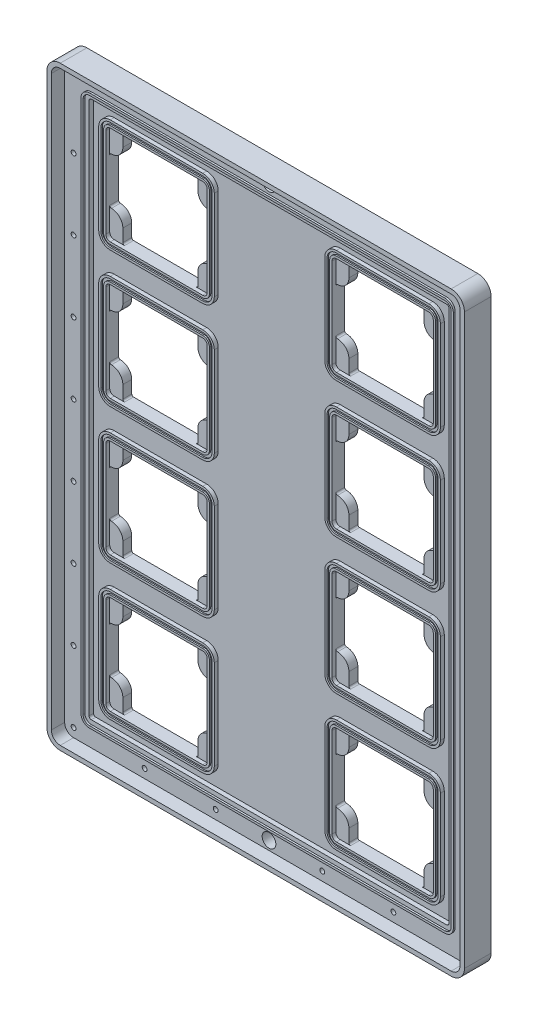
from build123d import *

# Parameters (mm, degrees)
SKETCH1_W            = 292.1
SKETCH1_H            = 419.1
BOSS_EXTRUDE1_DEPTH  = 9.525
SKETCH4_R            = 1.7272
CUT_EXTRUDE1_DEPTH   = 6.985
LPATTERN2_COUNT      = 8
LPATTERN2_PITCH      = 50.8
CUT_EXTRUDE3_DEPTH   = 3.175
BOSS_EXTRUDE2_DEPTH  = 1.3335
FILLET1_R            = 6.35
CUT_EXTRUDE5_DEPTH   = 3.175
CUT_EXTRUDE6_DEPTH   = 511.964898033
SKETCH11_R           = 1.1303
CUT_EXTRUDE7_DEPTH   = 3.96875
BOSS_EXTRUDE3_DEPTH  = 2.794
BOSS_EXTRUDE4_DEPTH  = 1.778
LPATTERN1_COUNT      = 2
LPATTERN1_PITCH      = 161.5948
LPATTERN1_COUNT_DIR2 = 4
LPATTERN1_PITCH_DIR2 = 96.8756
BOSS_EXTRUDE5_START  = -19.05
BOSS_EXTRUDE5_DEPTH  = 19.05
SKETCH14_R           = 1.7272
CUT_EXTRUDE8_DEPTH   = 6.985
SKETCH15_R           = 4.9022
CUT_EXTRUDE9_DEPTH   = 516.358348021
LPATTERN3_COUNT      = 2
LPATTERN3_PITCH      = 406.4


with BuildPart() as part:
    # Sketch1 → Boss-Extrude1 (new body)
    with BuildSketch(Plane.XY):
        with Locations((146.05, 209.55)):
            Rectangle(SKETCH1_W, SKETCH1_H)
    extrude(amount=BOSS_EXTRUDE1_DEPTH)

    # Sketch4 → Cut-Extrude1 (cut)
    with BuildSketch(Plane.XY.offset(9.525)):
        with Locations((6.35, 6.35)):
            Circle(SKETCH4_R)
        with Locations((6.35, 412.75)):
            Circle(SKETCH4_R)
        with Locations((285.75, 412.75)):
            Circle(SKETCH4_R)
        with Locations((285.75, 6.35)):
            Circle(SKETCH4_R)
    cut_extrude1 = extrude(amount=-CUT_EXTRUDE1_DEPTH, mode=Mode.SUBTRACT)

    # LPattern2: Cut-Extrude1 ×8
    with Locations(*[(0, -i * LPATTERN2_PITCH, 0) for i in range(1, LPATTERN2_COUNT)]):
        add(cut_extrude1, mode=Mode.SUBTRACT)

    # Sketch6 → Cut-Extrude3 (cut)
    with BuildSketch(Plane.XY.offset(9.525)):
        with BuildLine():
            Line((273.05, 401.6375), (19.05, 401.6375))
            ThreePointArc((19.05, 401.6375), (17.927467985, 401.172532015), (17.4625, 400.05))
            Line((17.4625, 400.05), (17.4625, 19.05))
            ThreePointArc((17.4625, 19.05), (17.927467985, 17.927467985), (19.05, 17.4625))
            Line((19.05, 17.4625), (273.05, 17.4625))
            ThreePointArc((273.05, 17.4625), (274.172532015, 17.927467985), (274.6375, 19.05))
            Line((274.6375, 19.05), (274.6375, 400.05))
            ThreePointArc((274.6375, 400.05), (274.172532015, 401.172532015), (273.05, 401.6375))
        make_face()
    extrude(amount=-CUT_EXTRUDE3_DEPTH, mode=Mode.SUBTRACT)

    # Sketch5 → Boss-Extrude2 (add)
    with BuildSketch(Plane.XY.offset(9.525)):
        with BuildLine():
            ThreePointArc((19.05, 406.146), (14.739477062, 404.360522938), (12.954, 400.05))
            Line((12.954, 400.05), (12.954, 19.05))
            ThreePointArc((12.954, 19.05), (14.739477062, 14.739477062), (19.05, 12.954))
            Line((19.05, 12.954), (273.05, 12.954))
            ThreePointArc((273.05, 12.954), (277.360522938, 14.739477062), (279.146, 19.05))
            Line((279.146, 19.05), (279.146, 400.05))
            ThreePointArc((279.146, 400.05), (277.360522938, 404.360522938), (273.05, 406.146))
            Line((273.05, 406.146), (19.05, 406.146))
        make_face()
        with BuildLine():
            ThreePointArc((273.05, 404.622), (276.282892204, 403.282892204), (277.622, 400.05))
            Line((277.622, 400.05), (277.622, 19.05))
            ThreePointArc((277.622, 19.05), (276.282892204, 15.817107796), (273.05, 14.478))
            Line((273.05, 14.478), (19.05, 14.478))
            ThreePointArc((19.05, 14.478), (15.817107796, 15.817107796), (14.478, 19.05))
            Line((14.478, 19.05), (14.478, 400.05))
            ThreePointArc((14.478, 400.05), (15.817107796, 403.282892204), (19.05, 404.622))
            Line((19.05, 404.622), (273.05, 404.622))
        make_face(mode=Mode.SUBTRACT)
    extrude(amount=BOSS_EXTRUDE2_DEPTH)

    # Fillet1
    fillet1_edges = [part.edges().sort_by_distance(p)[0] for p in [
        (0, 419.1, 4.7625),
        (292.1, 419.1, 4.7625),
        (0, 0, 4.7625),
        (292.1, 0, 4.7625),
    ]]
    fillet(fillet1_edges, radius=FILLET1_R)

    # Sketch8 → Cut-Extrude5 (cut)
    with BuildSketch(Plane(origin=(0, 0, 0), x_dir=(-1, 0, 0), z_dir=(0, 0, -1))):
        with BuildLine():
            Line((-201.2442, 393.7), (-252.4506, 393.7))
            ThreePointArc((-252.4506, 393.7), (-255.881057838, 392.279057838), (-257.302, 388.8486))
            Line((-257.302, 388.8486), (-257.302, 379.857))
            ThreePointArc((-257.302, 379.857), (-258.633668309, 376.642068309), (-261.8486, 375.3104))
            ThreePointArc((-261.8486, 375.3104), (-265.279057838, 373.889457838), (-266.7, 370.459))
            Line((-266.7, 370.459), (-266.7, 339.2678))
            ThreePointArc((-266.7, 339.2678), (-265.279057838, 335.837342162), (-261.8486, 334.4164))
            ThreePointArc((-261.8486, 334.4164), (-258.633668309, 333.084731691), (-257.302, 329.8698))
            Line((-257.302, 329.8698), (-257.302, 320.8782))
            ThreePointArc((-257.302, 320.8782), (-255.881057838, 317.447742162), (-252.4506, 316.0268))
            Line((-252.4506, 316.0268), (-201.2442, 316.0268))
            ThreePointArc((-201.2442, 316.0268), (-197.813742162, 317.447742162), (-196.3928, 320.8782))
            Line((-196.3928, 320.8782), (-196.3928, 329.8698))
            ThreePointArc((-196.3928, 329.8698), (-195.061131691, 333.084731691), (-191.8462, 334.4164))
            ThreePointArc((-191.8462, 334.4164), (-188.415742162, 335.837342162), (-186.9948, 339.2678))
            Line((-186.9948, 339.2678), (-186.9948, 370.459))
            ThreePointArc((-186.9948, 370.459), (-188.415742162, 373.889457838), (-191.8462, 375.3104))
            ThreePointArc((-191.8462, 375.3104), (-195.061131691, 376.642068309), (-196.3928, 379.857))
            Line((-196.3928, 379.857), (-196.3928, 388.8486))
            ThreePointArc((-196.3928, 388.8486), (-197.813742162, 392.279057838), (-201.2442, 393.7))
        make_face()
        with BuildLine():
            Line((-264.668, 370.459), (-264.668, 339.2678))
            ThreePointArc((-264.668, 339.2678), (-263.842216859, 337.274183141), (-261.8486, 336.4484))
            ThreePointArc((-261.8486, 336.4484), (-257.196827329, 334.521572671), (-255.27, 329.8698))
            Line((-255.27, 329.8698), (-255.27, 320.8782))
            ThreePointArc((-255.27, 320.8782), (-254.444216859, 318.884583141), (-252.4506, 318.0588))
            Line((-252.4506, 318.0588), (-201.2442, 318.0588))
            ThreePointArc((-201.2442, 318.0588), (-199.250583141, 318.884583141), (-198.4248, 320.8782))
            Line((-198.4248, 320.8782), (-198.4248, 329.8698))
            ThreePointArc((-198.4248, 329.8698), (-196.497972671, 334.521572671), (-191.8462, 336.4484))
            ThreePointArc((-191.8462, 336.4484), (-189.852583141, 337.274183141), (-189.0268, 339.2678))
            Line((-189.0268, 339.2678), (-189.0268, 370.459))
            ThreePointArc((-189.0268, 370.459), (-189.852583141, 372.452616859), (-191.8462, 373.2784))
            ThreePointArc((-191.8462, 373.2784), (-196.497972671, 375.205227329), (-198.4248, 379.857))
            Line((-198.4248, 379.857), (-198.4248, 388.8486))
            ThreePointArc((-198.4248, 388.8486), (-199.250583141, 390.842216859), (-201.2442, 391.668))
            Line((-201.2442, 391.668), (-252.4506, 391.668))
            ThreePointArc((-252.4506, 391.668), (-254.444216859, 390.842216859), (-255.27, 388.8486))
            Line((-255.27, 388.8486), (-255.27, 379.857))
            ThreePointArc((-255.27, 379.857), (-257.196827329, 375.205227329), (-261.8486, 373.2784))
            ThreePointArc((-261.8486, 373.2784), (-263.842216859, 372.452616859), (-264.668, 370.459))
        make_face(mode=Mode.SUBTRACT)
    cut_extrude5 = extrude(amount=-CUT_EXTRUDE5_DEPTH, mode=Mode.SUBTRACT)

    # Sketch10 → Cut-Extrude6 (cut, through all)
    with BuildSketch(Plane(origin=(0, 0, 0), x_dir=(-1, 0, 0), z_dir=(0, 0, -1))):
        with BuildLine():
            Line((-263.0805, 370.459), (-263.0805, 339.2678))
            ThreePointArc((-263.0805, 339.2678), (-262.719684844, 338.396715156), (-261.8486, 338.0359))
            ThreePointArc((-261.8486, 338.0359), (-256.074295314, 335.644104686), (-253.6825, 329.8698))
            Line((-253.6825, 329.8698), (-253.6825, 320.8782))
            ThreePointArc((-253.6825, 320.8782), (-253.321684844, 320.007115156), (-252.4506, 319.6463))
            Line((-252.4506, 319.6463), (-201.2442, 319.6463))
            ThreePointArc((-201.2442, 319.6463), (-200.373115156, 320.007115156), (-200.0123, 320.8782))
            Line((-200.0123, 320.8782), (-200.0123, 329.8698))
            ThreePointArc((-200.0123, 329.8698), (-197.620504686, 335.644104686), (-191.8462, 338.0359))
            ThreePointArc((-191.8462, 338.0359), (-190.975115156, 338.396715156), (-190.6143, 339.2678))
            Line((-190.6143, 339.2678), (-190.6143, 370.459))
            ThreePointArc((-190.6143, 370.459), (-190.975115156, 371.330084844), (-191.8462, 371.6909))
            ThreePointArc((-191.8462, 371.6909), (-197.620504686, 374.082695314), (-200.0123, 379.857))
            Line((-200.0123, 379.857), (-200.0123, 388.8486))
            ThreePointArc((-200.0123, 388.8486), (-200.373115156, 389.719684844), (-201.2442, 390.0805))
            Line((-201.2442, 390.0805), (-252.4506, 390.0805))
            ThreePointArc((-252.4506, 390.0805), (-253.321684844, 389.719684844), (-253.6825, 388.8486))
            Line((-253.6825, 388.8486), (-253.6825, 379.857))
            ThreePointArc((-253.6825, 379.857), (-256.074295314, 374.082695314), (-261.8486, 371.6909))
            ThreePointArc((-261.8486, 371.6909), (-262.719684844, 371.330084844), (-263.0805, 370.459))
        make_face()
    cut_extrude6 = extrude(amount=-CUT_EXTRUDE6_DEPTH, mode=Mode.SUBTRACT)

    # Sketch11 → Cut-Extrude7 (cut)
    with BuildSketch(Plane(origin=(0, 0, 0), x_dir=(-1, 0, 0), z_dir=(0, 0, -1))):
        with Locations((-261.8486, 388.8994)):
            Circle(SKETCH11_R)
        with Locations((-191.8462, 388.8994)):
            Circle(SKETCH11_R)
        with Locations((-191.8462, 320.8274)):
            Circle(SKETCH11_R)
        with Locations((-261.8486, 320.8274)):
            Circle(SKETCH11_R)
    cut_extrude7 = extrude(amount=-CUT_EXTRUDE7_DEPTH, mode=Mode.SUBTRACT)

    # Sketch12 → Boss-Extrude3 (add)
    # profile 1 of 2: a face of its own
    with BuildSketch(Plane.XY.offset(6.35)):
        with BuildLine():
            ThreePointArc((193.7893, 395.1605), (187.952133521, 392.742666479), (185.5343, 386.9055))
            Line((185.5343, 386.9055), (185.5343, 322.8213))
            ThreePointArc((185.5343, 322.8213), (187.952133521, 316.984133521), (193.7893, 314.5663))
            Line((193.7893, 314.5663), (259.9055, 314.5663))
            ThreePointArc((259.9055, 314.5663), (265.742666479, 316.984133521), (268.1605, 322.8213))
            Line((268.1605, 322.8213), (268.1605, 386.9055))
            ThreePointArc((268.1605, 386.9055), (265.742666479, 392.742666479), (259.9055, 395.1605))
            Line((259.9055, 395.1605), (193.7893, 395.1605))
        make_face()
        with BuildLine():
            Line((187.1218, 322.8213), (187.1218, 386.9055))
            ThreePointArc((187.1218, 386.9055), (189.074665536, 391.620134464), (193.7893, 393.573))
            Line((193.7893, 393.573), (259.9055, 393.573))
            ThreePointArc((259.9055, 393.573), (264.620134464, 391.620134464), (266.573, 386.9055))
            Line((266.573, 386.9055), (266.573, 322.8213))
            ThreePointArc((266.573, 322.8213), (264.620134464, 318.106665536), (259.9055, 316.1538))
            Line((259.9055, 316.1538), (193.7893, 316.1538))
            ThreePointArc((193.7893, 316.1538), (189.074665536, 318.106665536), (187.1218, 322.8213))
        make_face(mode=Mode.SUBTRACT)
    # profile 2 of 2: a face of its own
    with BuildSketch(Plane.XY.offset(6.35)):
        with BuildLine():
            Line((259.9055, 391.668), (193.7893, 391.668))
            ThreePointArc((193.7893, 391.668), (190.421703955, 390.273096045), (189.0268, 386.9055))
            Line((189.0268, 386.9055), (189.0268, 322.8213))
            ThreePointArc((189.0268, 322.8213), (190.421703955, 319.453703955), (193.7893, 318.0588))
            Line((193.7893, 318.0588), (259.9055, 318.0588))
            ThreePointArc((259.9055, 318.0588), (263.273096045, 319.453703955), (264.668, 322.8213))
            Line((264.668, 322.8213), (264.668, 386.9055))
            ThreePointArc((264.668, 386.9055), (263.273096045, 390.273096045), (259.9055, 391.668))
        make_face()
        with BuildLine():
            ThreePointArc((190.6143, 386.9055), (191.54423597, 389.15056403), (193.7893, 390.0805))
            Line((193.7893, 390.0805), (259.9055, 390.0805))
            ThreePointArc((259.9055, 390.0805), (262.15056403, 389.15056403), (263.0805, 386.9055))
            Line((263.0805, 386.9055), (263.0805, 322.8213))
            ThreePointArc((263.0805, 322.8213), (262.15056403, 320.57623597), (259.9055, 319.6463))
            Line((259.9055, 319.6463), (193.7893, 319.6463))
            ThreePointArc((193.7893, 319.6463), (191.54423597, 320.57623597), (190.6143, 322.8213))
            Line((190.6143, 322.8213), (190.6143, 386.9055))
        make_face(mode=Mode.SUBTRACT)
    boss_extrude3 = extrude(amount=BOSS_EXTRUDE3_DEPTH)

    # Sketch12<3> → Boss-Extrude4 (add)
    with BuildSketch(Plane.XY.offset(6.35)):
        with BuildLine():
            ThreePointArc((193.7893, 393.573), (189.074665536, 391.620134464), (187.1218, 386.9055))
            Line((187.1218, 386.9055), (187.1218, 322.8213))
            ThreePointArc((187.1218, 322.8213), (189.074665536, 318.106665536), (193.7893, 316.1538))
            Line((193.7893, 316.1538), (259.9055, 316.1538))
            ThreePointArc((259.9055, 316.1538), (264.620134464, 318.106665536), (266.573, 322.8213))
            Line((266.573, 322.8213), (266.573, 386.9055))
            ThreePointArc((266.573, 386.9055), (264.620134464, 391.620134464), (259.9055, 393.573))
            Line((259.9055, 393.573), (193.7893, 393.573))
        make_face()
        with BuildLine():
            ThreePointArc((189.0268, 386.9055), (190.421703955, 390.273096045), (193.7893, 391.668))
            Line((193.7893, 391.668), (259.9055, 391.668))
            ThreePointArc((259.9055, 391.668), (263.273096045, 390.273096045), (264.668, 386.9055))
            Line((264.668, 386.9055), (264.668, 322.8213))
            ThreePointArc((264.668, 322.8213), (263.273096045, 319.453703955), (259.9055, 318.0588))
            Line((259.9055, 318.0588), (193.7893, 318.0588))
            ThreePointArc((193.7893, 318.0588), (190.421703955, 319.453703955), (189.0268, 322.8213))
            Line((189.0268, 322.8213), (189.0268, 386.9055))
        make_face(mode=Mode.SUBTRACT)
    boss_extrude4 = extrude(amount=BOSS_EXTRUDE4_DEPTH)

    # LPattern1: Cut-Extrude5, Cut-Extrude6, Cut-Extrude7, Boss-Extrude3, Boss-Extrude4 2 × 4
    with Locations(*[(-i * LPATTERN1_PITCH, -j * LPATTERN1_PITCH_DIR2, 0) for i in range(LPATTERN1_COUNT) for j in range(LPATTERN1_COUNT_DIR2) if (i, j) != (0, 0)]):
        add(cut_extrude5, mode=Mode.SUBTRACT)
        add(cut_extrude6, mode=Mode.SUBTRACT)
        add(cut_extrude7, mode=Mode.SUBTRACT)
        add(boss_extrude3)
        add(boss_extrude4)

    # Sketch13 → Boss-Extrude5 (add)
    with BuildSketch(Plane(origin=(0, 0, 0), x_dir=(-1, 0, 0), z_dir=(0, 0, -1)).offset(BOSS_EXTRUDE5_START)):
        with BuildLine():
            Line((-285.75, -3.175), (-6.35, -3.175))
            ThreePointArc((-6.35, -3.175), (0.385192091, -0.385192091), (3.175, 6.35))
            Line((3.175, 6.35), (3.175, 412.75))
            ThreePointArc((3.175, 412.75), (0.385192091, 419.485192091), (-6.35, 422.275))
            Line((-6.35, 422.275), (-285.75, 422.275))
            ThreePointArc((-285.75, 422.275), (-292.485192091, 419.485192091), (-295.275, 412.75))
            Line((-295.275, 412.75), (-295.275, 6.35))
            ThreePointArc((-295.275, 6.35), (-292.485192091, -0.385192091), (-285.75, -3.175))
        make_face()
        with BuildLine():
            Line((-6.35, 419.1), (-285.75, 419.1))
            ThreePointArc((-285.75, 419.1), (-290.240128061, 417.240128061), (-292.1, 412.75))
            Line((-292.1, 412.75), (-292.1, 6.35))
            ThreePointArc((-292.1, 6.35), (-290.240128061, 1.859871939), (-285.75, 0))
            Line((-285.75, 0), (-6.35, 0))
            ThreePointArc((-6.35, 0), (-1.859871939, 1.859871939), (0, 6.35))
            Line((0, 6.35), (0, 412.75))
            ThreePointArc((0, 412.75), (-1.859871939, 417.240128061), (-6.35, 419.1))
        make_face(mode=Mode.SUBTRACT)
    extrude(amount=BOSS_EXTRUDE5_DEPTH)

    # Sketch14 → Cut-Extrude8 (cut)
    with BuildSketch(Plane.XY.offset(9.525)):
        with Locations((234.95, 6.35)):
            Circle(SKETCH14_R)
        with Locations((184.15, 6.35)):
            Circle(SKETCH14_R)
        with Locations((107.95, 6.35)):
            Circle(SKETCH14_R)
        with Locations((57.15, 6.35)):
            Circle(SKETCH14_R)
    cut_extrude8 = extrude(amount=-CUT_EXTRUDE8_DEPTH, mode=Mode.SUBTRACT)

    # Sketch15 → Cut-Extrude9 (cut, through all)
    with BuildSketch(Plane.XY.offset(9.525)):
        with Locations((146.05, 6.35)):
            Circle(SKETCH15_R)
    cut_extrude9 = extrude(amount=-CUT_EXTRUDE9_DEPTH, mode=Mode.SUBTRACT)

    # LPattern3: Cut-Extrude8, Cut-Extrude9 ×2
    with Locations(*[(0, i * LPATTERN3_PITCH, 0) for i in range(1, LPATTERN3_COUNT)]):
        add(cut_extrude8, mode=Mode.SUBTRACT)
        add(cut_extrude9, mode=Mode.SUBTRACT)


solid = part.part
